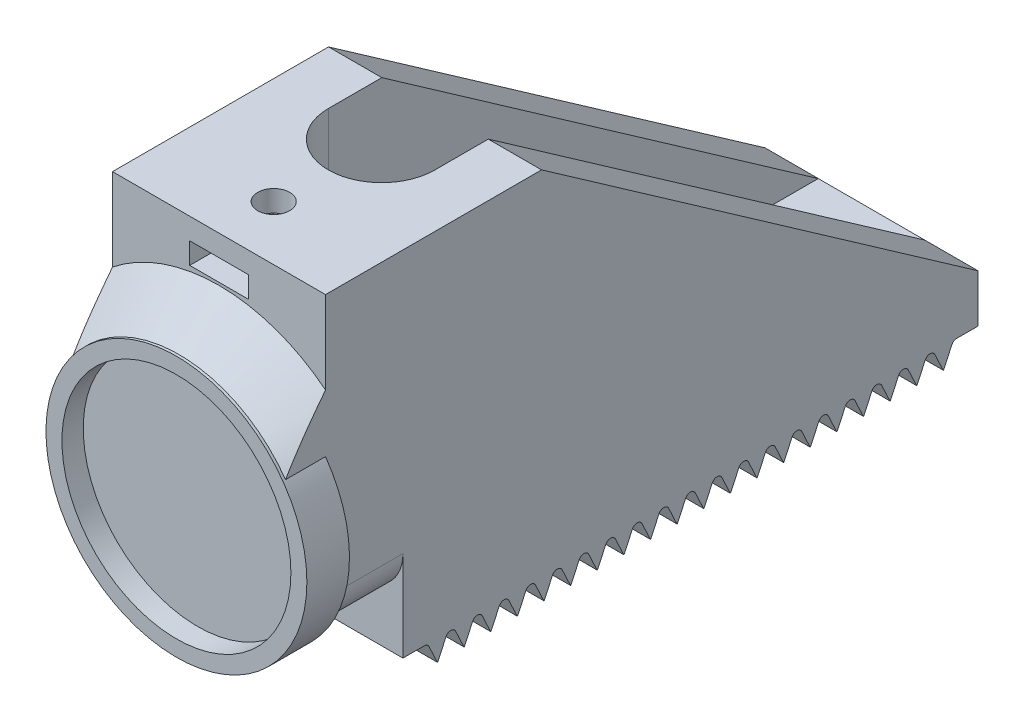
from build123d import *

# Parameters (mm, degrees)
SKETCH1_R           = 12.25
BOSS_EXTRUDE1_DEPTH = 2
SKETCH2_R           = 12.25
SKETCH2_R_2         = 10.75
BOSS_EXTRUDE2_DEPTH = 2
BOSS_EXTRUDE3_DEPTH = 10
SKETCH4_W           = 20
SKETCH4_H           = 54
BOSS_EXTRUDE4_DEPTH = 2
CUT_EXTRUDE1_START  = -4.462225
CUT_EXTRUDE1_DEPTH  = 4.462225
BOSS_EXTRUDE6_START = -5
BOSS_EXTRUDE6_DEPTH = 5
BOSS_EXTRUDE7_START = -20
BOSS_EXTRUDE7_DEPTH = 5
BOSS_EXTRUDE8_DEPTH = 28.697043475
FILLET1_R           = 4
CHAMFER1_SIZE       = 3.75
SKETCH7_R           = 1.5
CUT_EXTRUDE2_DEPTH  = 20
CUT_EXTRUDE3_DEPTH  = 2
CHAMFER2_SIZE       = 1


with BuildPart() as part:
    # Sketch1 → Boss-Extrude1 (new body)
    with BuildSketch(Plane.XY):
        Circle(SKETCH1_R)
    extrude(amount=BOSS_EXTRUDE1_DEPTH)

    # Sketch2 → Boss-Extrude2 (add)
    with BuildSketch(Plane.XY.offset(2)):
        Circle(SKETCH2_R)
        Circle(SKETCH2_R_2, mode=Mode.SUBTRACT)
    extrude(amount=BOSS_EXTRUDE2_DEPTH)



with BuildPart() as body_2:
    # Sketch3 → Boss-Extrude3 (new, symmetric)
    with BuildSketch(Plane(origin=(0, 0, 0), x_dir=(0, 0, -1), z_dir=(1, 0, 0))):
        with BuildLine():
            Line((57.995288818, -14.894345435), (57.221865765, -13.235734344))
            ThreePointArc((57.221865765, -13.235734344), (57.037361675, -13.025347752), (56.768711871, -12.947043475))
            ThreePointArc((56.768711871, -12.947043475), (56.500062067, -13.025347752), (56.315557978, -13.235734344))
            Line((56.315557978, -13.235734344), (55.542134924, -14.894345435))
            ThreePointArc((55.542134924, -14.894345435), (55.518711871, -14.909267565), (55.495288818, -14.894345435))
            Line((55.495288818, -14.894345435), (54.721865765, -13.235734344))
            ThreePointArc((54.721865765, -13.235734344), (54.537361675, -13.025347752), (54.268711871, -12.947043475))
            ThreePointArc((54.268711871, -12.947043475), (54.000062067, -13.025347752), (53.815557978, -13.235734344))
            Line((53.815557978, -13.235734344), (53.042134924, -14.894345435))
            ThreePointArc((53.042134924, -14.894345435), (53.018711871, -14.909267565), (52.995288818, -14.894345435))
            Line((52.995288818, -14.894345435), (52.221865765, -13.235734344))
            ThreePointArc((52.221865765, -13.235734344), (52.037361675, -13.025347752), (51.768711871, -12.947043475))
            ThreePointArc((51.768711871, -12.947043475), (51.500062067, -13.025347752), (51.315557978, -13.235734344))
            Line((51.315557978, -13.235734344), (50.542134924, -14.894345435))
            ThreePointArc((50.542134924, -14.894345435), (50.518711871, -14.909267565), (50.495288818, -14.894345435))
            Line((50.495288818, -14.894345435), (49.721865765, -13.235734344))
            ThreePointArc((49.721865765, -13.235734344), (49.537361675, -13.025347752), (49.268711871, -12.947043475))
            ThreePointArc((49.268711871, -12.947043475), (49.000062067, -13.025347752), (48.815557978, -13.235734344))
            Line((48.815557978, -13.235734344), (48.042134924, -14.894345435))
            ThreePointArc((48.042134924, -14.894345435), (48.018711871, -14.909267565), (47.995288818, -14.894345435))
            Line((47.995288818, -14.894345435), (47.221865765, -13.235734344))
            ThreePointArc((47.221865765, -13.235734344), (47.037361675, -13.025347752), (46.768711871, -12.947043475))
            ThreePointArc((46.768711871, -12.947043475), (46.500062067, -13.025347752), (46.315557978, -13.235734344))
            Line((46.315557978, -13.235734344), (45.542134924, -14.894345435))
            ThreePointArc((45.542134924, -14.894345435), (45.518711871, -14.909267565), (45.495288818, -14.894345435))
            Line((45.495288818, -14.894345435), (44.721865765, -13.235734344))
            ThreePointArc((44.721865765, -13.235734344), (44.537361675, -13.025347752), (44.268711871, -12.947043475))
            ThreePointArc((44.268711871, -12.947043475), (44.000062067, -13.025347752), (43.815557978, -13.235734344))
            Line((43.815557978, -13.235734344), (43.042134924, -14.894345435))
            ThreePointArc((43.042134924, -14.894345435), (43.018711871, -14.909267565), (42.995288818, -14.894345435))
            Line((42.995288818, -14.894345435), (42.221865765, -13.235734344))
            ThreePointArc((42.221865765, -13.235734344), (42.037361675, -13.025347752), (41.768711871, -12.947043475))
            ThreePointArc((41.768711871, -12.947043475), (41.500062067, -13.025347752), (41.315557978, -13.235734344))
            Line((41.315557978, -13.235734344), (40.542134924, -14.894345435))
            ThreePointArc((40.542134924, -14.894345435), (40.518711871, -14.909267565), (40.495288818, -14.894345435))
            Line((40.495288818, -14.894345435), (39.721865765, -13.235734344))
            ThreePointArc((39.721865765, -13.235734344), (39.537361675, -13.025347752), (39.268711871, -12.947043475))
            ThreePointArc((39.268711871, -12.947043475), (39.000062067, -13.025347752), (38.815557978, -13.235734344))
            Line((38.815557978, -13.235734344), (38.042134924, -14.894345435))
            ThreePointArc((38.042134924, -14.894345435), (38.018711871, -14.909267565), (37.995288818, -14.894345435))
            Line((37.995288818, -14.894345435), (37.221865765, -13.235734344))
            ThreePointArc((37.221865765, -13.235734344), (37.037361675, -13.025347752), (36.768711871, -12.947043475))
            ThreePointArc((36.768711871, -12.947043475), (36.500062067, -13.025347752), (36.315557978, -13.235734344))
            Line((36.315557978, -13.235734344), (35.542134924, -14.894345435))
            ThreePointArc((35.542134924, -14.894345435), (35.518711871, -14.909267565), (35.495288818, -14.894345435))
            Line((35.495288818, -14.894345435), (34.721865765, -13.235734344))
            ThreePointArc((34.721865765, -13.235734344), (34.537361675, -13.025347752), (34.268711871, -12.947043475))
            ThreePointArc((34.268711871, -12.947043475), (34.000062067, -13.025347752), (33.815557978, -13.235734344))
            Line((33.815557978, -13.235734344), (33.042134924, -14.894345435))
            ThreePointArc((33.042134924, -14.894345435), (33.018711871, -14.909267565), (32.995288818, -14.894345435))
            Line((32.995288818, -14.894345435), (32.221865765, -13.235734344))
            ThreePointArc((32.221865765, -13.235734344), (32.037361675, -13.025347752), (31.768711871, -12.947043475))
            ThreePointArc((31.768711871, -12.947043475), (31.500062067, -13.025347752), (31.315557978, -13.235734344))
            Line((31.315557978, -13.235734344), (30.542134924, -14.894345435))
            ThreePointArc((30.542134924, -14.894345435), (30.518711871, -14.909267565), (30.495288818, -14.894345435))
            Line((30.495288818, -14.894345435), (29.721865765, -13.235734344))
            ThreePointArc((29.721865765, -13.235734344), (29.537361675, -13.025347752), (29.268711871, -12.947043475))
            ThreePointArc((29.268711871, -12.947043475), (29.000062067, -13.025347752), (28.815557978, -13.235734344))
            Line((28.815557978, -13.235734344), (28.042134924, -14.894345435))
            ThreePointArc((28.042134924, -14.894345435), (28.018711871, -14.909267565), (27.995288818, -14.894345435))
            Line((27.995288818, -14.894345435), (27.221865765, -13.235734344))
            ThreePointArc((27.221865765, -13.235734344), (27.037361675, -13.025347752), (26.768711871, -12.947043475))
            ThreePointArc((26.768711871, -12.947043475), (26.500062067, -13.025347752), (26.315557978, -13.235734344))
            Line((26.315557978, -13.235734344), (25.542134924, -14.894345435))
            ThreePointArc((25.542134924, -14.894345435), (25.518711871, -14.909267565), (25.495288818, -14.894345435))
            Line((25.495288818, -14.894345435), (24.721865765, -13.235734344))
            ThreePointArc((24.721865765, -13.235734344), (24.537361675, -13.025347752), (24.268711871, -12.947043475))
            ThreePointArc((24.268711871, -12.947043475), (24.000062067, -13.025347752), (23.815557978, -13.235734344))
            Line((23.815557978, -13.235734344), (23.042134924, -14.894345435))
            ThreePointArc((23.042134924, -14.894345435), (23.018711871, -14.909267565), (22.995288818, -14.894345435))
            Line((22.995288818, -14.894345435), (22.221865765, -13.235734344))
            ThreePointArc((22.221865765, -13.235734344), (22.037361675, -13.025347752), (21.768711871, -12.947043475))
            ThreePointArc((21.768711871, -12.947043475), (21.500062067, -13.025347752), (21.315557978, -13.235734344))
            Line((21.315557978, -13.235734344), (20.542134924, -14.894345435))
            ThreePointArc((20.542134924, -14.894345435), (20.518711871, -14.909267565), (20.495288818, -14.894345435))
            Line((20.495288818, -14.894345435), (19.721865765, -13.235734344))
            ThreePointArc((19.721865765, -13.235734344), (19.537361675, -13.025347752), (19.268711871, -12.947043475))
            ThreePointArc((19.268711871, -12.947043475), (19.000062067, -13.025347752), (18.815557978, -13.235734344))
            Line((18.815557978, -13.235734344), (18.042134924, -14.894345435))
            ThreePointArc((18.042134924, -14.894345435), (18.018711871, -14.909267565), (17.995288818, -14.894345435))
            Line((17.995288818, -14.894345435), (17.221865765, -13.235734344))
            ThreePointArc((17.221865765, -13.235734344), (17.037361675, -13.025347752), (16.768711871, -12.947043475))
            ThreePointArc((16.768711871, -12.947043475), (16.500062067, -13.025347752), (16.315557978, -13.235734344))
            Line((16.315557978, -13.235734344), (15.542134924, -14.894345435))
            ThreePointArc((15.542134924, -14.894345435), (15.518711871, -14.909267565), (15.495288818, -14.894345435))
            Line((15.495288818, -14.894345435), (14.721865765, -13.235734344))
            ThreePointArc((14.721865765, -13.235734344), (14.537361675, -13.025347752), (14.268711871, -12.947043475))
            ThreePointArc((14.268711871, -12.947043475), (14.000062067, -13.025347752), (13.815557978, -13.235734344))
            Line((13.815557978, -13.235734344), (13.042134924, -14.894345435))
            ThreePointArc((13.042134924, -14.894345435), (13.018711871, -14.909267565), (12.995288818, -14.894345435))
            Line((12.995288818, -14.894345435), (12.221865765, -13.235734344))
            ThreePointArc((12.221865765, -13.235734344), (12.037361675, -13.025347752), (11.768711871, -12.947043475))
            ThreePointArc((11.768711871, -12.947043475), (11.500062067, -13.025347752), (11.315557978, -13.235734344))
            Line((11.315557978, -13.235734344), (10.542134924, -14.894345435))
            ThreePointArc((10.542134924, -14.894345435), (10.518711871, -14.909267565), (10.495288818, -14.894345435))
            Line((10.495288818, -14.894345435), (9.721865765, -13.235734344))
            ThreePointArc((9.721865765, -13.235734344), (9.537361675, -13.025347752), (9.268711871, -12.947043475))
            Line((9.268711871, -12.947043475), (7.268711871, -12.947043475))
            Line((7.268711871, -12.947043475), (7.268711871, -10.447043475))
            Line((7.268711871, -10.447043475), (61.268711871, -10.447043475))
            Line((61.268711871, -10.447043475), (61.268711871, -12.947043475))
            Line((61.268711871, -12.947043475), (59.268711871, -12.947043475))
            ThreePointArc((59.268711871, -12.947043475), (59.000062067, -13.025347752), (58.815557978, -13.235734344))
            Line((58.815557978, -13.235734344), (58.042134924, -14.894345435))
            ThreePointArc((58.042134924, -14.894345435), (58.018711871, -14.909267565), (57.995288818, -14.894345435))
        make_face()
    extrude(amount=BOSS_EXTRUDE3_DEPTH, both=True)

    # Sketch4 → Boss-Extrude4 (add)
    with BuildSketch(Plane(origin=(0, -10.447043475, 0), x_dir=(1, 0, 0), z_dir=(0, 1, 0))):
        with Locations((0, 34.268711871)):
            Rectangle(SKETCH4_W, SKETCH4_H)
        with BuildLine():
            ThreePointArc((-5, 15.268711871), (0, 10.268711871), (5, 15.268711871))
            Line((5, 15.268711871), (5, 53.268711871))
            ThreePointArc((5, 53.268711871), (0, 58.268711871), (-5, 53.268711871))
            Line((-5, 53.268711871), (-5, 15.268711871))
        make_face(mode=Mode.SUBTRACT)
    extrude(amount=BOSS_EXTRUDE4_DEPTH)

    # Sketch4<3> → Cut-Extrude1 (cut)
    with BuildSketch(Plane(origin=(0, -10.447043475, 0), x_dir=(1, 0, 0), z_dir=(0, 1, 0)).offset(CUT_EXTRUDE1_START)):
        with BuildLine():
            Line((-2.75, 53.268711871), (-2.75, 15.268711871))
            ThreePointArc((-2.75, 15.268711871), (0, 12.518711871), (2.75, 15.268711871))
            Line((2.75, 15.268711871), (2.75, 53.268711871))
            ThreePointArc((2.75, 53.268711871), (0, 56.018711871), (-2.75, 53.268711871))
        make_face()
    extrude(amount=CUT_EXTRUDE1_DEPTH, mode=Mode.SUBTRACT)


with BuildPart() as part_1:
    add(part.part)

    add(body_2.part)  # Boss-Extrude6 merges body 2
    # Sketch5 → Boss-Extrude6 (add)
    with BuildSketch(Plane.ZY.offset(10).offset(BOSS_EXTRUDE6_START)):
        Polygon((-61.268711871, -8.447043475), (-20.285086433, 20.25), (0, 20.25), (0, 12.25), (0, -8.447043475), (-7.268711871, -8.447043475), align=None)
    extrude(amount=BOSS_EXTRUDE6_DEPTH)

    # Sketch5<2> → Boss-Extrude7 (add)
    with BuildSketch(Plane.ZY.offset(10).offset(BOSS_EXTRUDE7_START)):
        Polygon((-61.268711871, -8.447043475), (-20.285086433, 20.25), (0, 20.25), (0, 12.25), (0, -8.447043475), (-7.268711871, -8.447043475), align=None)
    extrude(amount=BOSS_EXTRUDE7_DEPTH)

    # Sketch6 → Boss-Extrude8 (add)
    with BuildSketch(Plane(origin=(0, -8.447043475, 0), x_dir=(1, 0, 0), z_dir=(0, 1, 0))):
        with BuildLine():
            Line((5, 15.268711871), (5, 0))
            Line((5, 0), (-5, 0))
            Line((-5, 0), (-5, 15.268711871))
            ThreePointArc((-5, 15.268711871), (0, 10.268711871), (5, 15.268711871))
        make_face()
    extrude(amount=BOSS_EXTRUDE8_DEPTH)

    # Fillet1
    # the kernel refuses this fillet: 4 mm, written as the material it takes off along each edge
    with BuildSketch(Plane(origin=(10, -8.447043475, -7.268711871), x_dir=(0, 1, 0), z_dir=(0, 0, 1))) as fillet1_piece_1:
        with BuildLine():
            CenterArc((FILLET1_R, FILLET1_R), FILLET1_R, 180, 90)
            Line((0, FILLET1_R), (0, 0))
            Line((0, 0), (FILLET1_R, 0))
        make_face()
    extrude(amount=7.268711871, mode=Mode.SUBTRACT)
    with BuildSketch(Plane(origin=(-10, -8.447043475, 0), x_dir=(1, 0, 0), z_dir=(0, 0, -1))) as fillet1_piece_2:
        with BuildLine():
            CenterArc((FILLET1_R, -FILLET1_R), FILLET1_R, 90, 90)
            Line((0, -FILLET1_R), (0, 0))
            Line((0, 0), (FILLET1_R, 0))
        make_face()
    extrude(amount=7.268711871, mode=Mode.SUBTRACT)

    # Chamfer1
    # the kernel refuses this chamfer: 3.75 mm, written as the material it adds along each edge
    with BuildSketch(Plane(origin=(0, 0, 0), x_dir=(-0.9852541221571711, -0.1710973838850322, 0), z_dir=(0.1710973838850322, -0.9852541221571711, 0))) as chamfer1_piece_1_section:
        Polygon((12.25 + CHAMFER1_SIZE, 0), (12.25, -CHAMFER1_SIZE), (12.25, 0), align=None)
    chamfer1_piece_1 = revolve(axis=Axis((0, 0, 0), (0, 0, -1)), revolution_arc=199.703258789, mode=Mode.PRIVATE)
    chamfer1_piece_1 = split(chamfer1_piece_1, bisect_by=Plane(origin=(10, 14.086701389, 1.836701389), z_dir=(-1, 0, 0)), keep=Keep.TOP, mode=Mode.PRIVATE)
    chamfer1_piece_1 = split(chamfer1_piece_1, bisect_by=Plane(origin=(-10, 14.086701389, 1.836701389), z_dir=(1, 0, 0)), keep=Keep.TOP, mode=Mode.PRIVATE)
    add(chamfer1_piece_1)

    # Sketch7 → Cut-Extrude2 (cut)
    with BuildSketch(Plane(origin=(0, 20.25, 0), x_dir=(1, 0, 0), z_dir=(0, 1, 0))):
        with Locations(Location((0, 5.134355936, 0), (0, 0, 270))):
            Circle(SKETCH7_R)
    extrude(amount=-CUT_EXTRUDE2_DEPTH, mode=Mode.SUBTRACT)

    # Sketch8 → Cut-Extrude3 (cut)
    with BuildSketch(Plane(origin=(0, 18.25, 0), x_dir=(1, 0, 0), z_dir=(0, 1, 0))):
        Polygon((2.75, 2.384355936), (2.75, -2), (-2.75, -2), (-2.75, 2.384355936), (-2.75, 7.884355936), (2.75, 7.884355936), align=None)
    extrude(amount=-CUT_EXTRUDE3_DEPTH, mode=Mode.SUBTRACT)

    # Chamfer2
    chamfer2_edges = [part_1.edges().sort_by_distance(p)[0] for p in [
        (0, 0.25, -6.634355936),
    ]]
    chamfer(chamfer2_edges, length=CHAMFER2_SIZE)


solid = part_1.part
